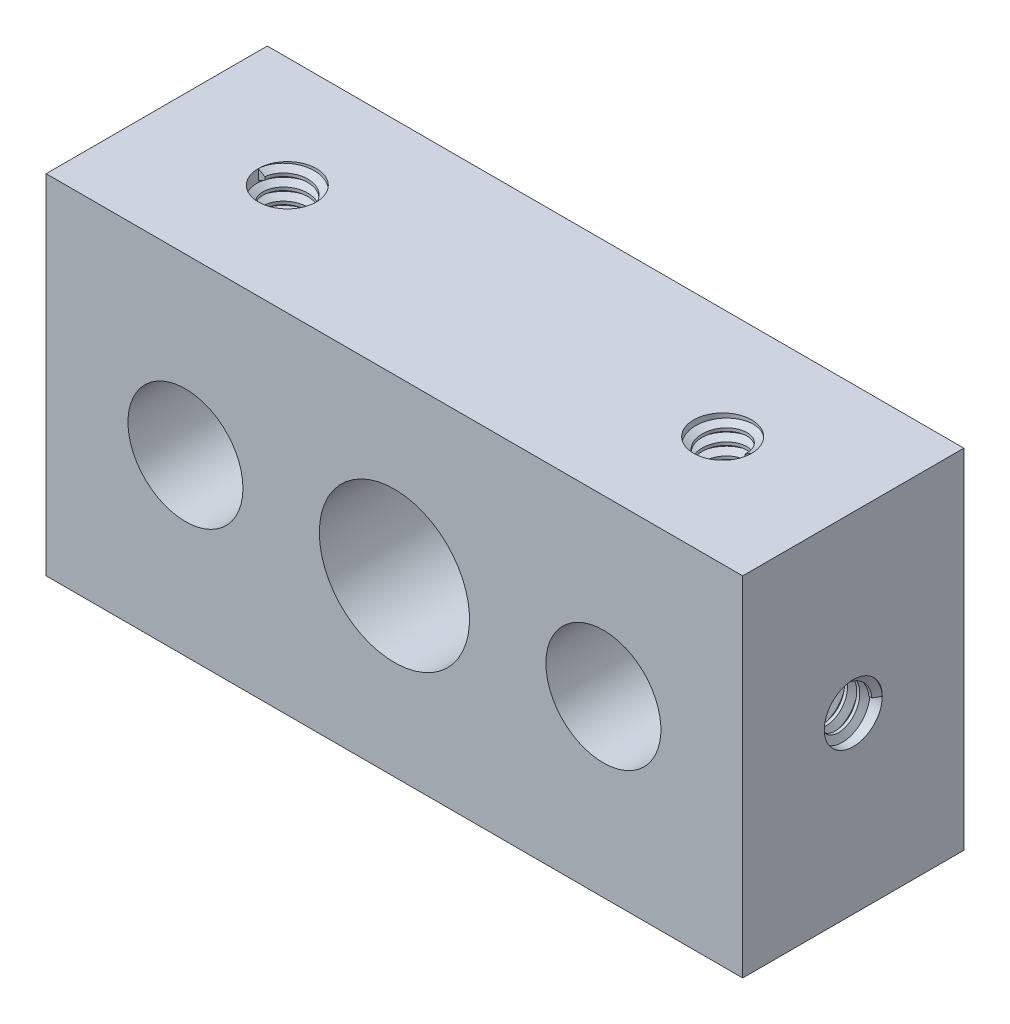
from build123d import *
from build123d.topology import SkipClean

# Parameters (mm, degrees)
SKETCH2_W                       = 40
SKETCH2_H                       = 12.7
BOSS_EXTRUDE1_DEPTH             = 20
TAP_DRILL_FOR_M4X0_7_TAP1_D     = 3.3
TAP_DRILL_FOR_M4X0_7_TAP1_DEPTH = 5
TAP_DRILL_FOR_M4X0_7_TAP1_TIP   = 0.99142
F_1_0MM_DOWEL_HOLE1_D           = 8.6233
F_1_0MM_DOWEL_HOLE1_DEPTH       = 18
F_1_0MM_DOWEL_HOLE1_TIP         = 2.590701
SKETCH8_R                       = 1.666
CUT_EXTRUDE1_DEPTH              = 8
THREAD2_PITCH                   = 0.7
TAP_DRILL_FOR_M4_TAP1_D         = 3.332
TAP_DRILL_FOR_M4_TAP1_DEPTH     = 4.825
TAP_DRILL_FOR_M4_TAP1_TIP       = 1.001034
THREAD3_PITCH                   = 0.7
SKETCH14_R                      = 3.302
CUT_EXTRUDE2_DEPTH              = 32.004901
THREAD4_PITCH                   = 0.7


with BuildPart() as part:
    # Sketch2 → Boss-Extrude1 (new body)
    with BuildSketch(Plane(origin=(0, 0, 0), x_dir=(1, 0, 0), z_dir=(0, 1, 0))):
        Rectangle(SKETCH2_W, SKETCH2_H)
    extrude(amount=BOSS_EXTRUDE1_DEPTH)

    # Tap Drill for M4x0.7 Tap1
    with Locations(Plane(origin=(0, 0, 0), x_dir=(-1, 0, 0), z_dir=(0, -1, 0))):
        with Locations((-12.5, 0), (12.5, 0)):
            Hole(TAP_DRILL_FOR_M4X0_7_TAP1_D / 2, depth=TAP_DRILL_FOR_M4X0_7_TAP1_DEPTH)
            with Locations((0, 0, -(TAP_DRILL_FOR_M4X0_7_TAP1_DEPTH + TAP_DRILL_FOR_M4X0_7_TAP1_TIP / 2))):  # 118° drill point
                Cone(0, TAP_DRILL_FOR_M4X0_7_TAP1_D / 2, TAP_DRILL_FOR_M4X0_7_TAP1_TIP, mode=Mode.SUBTRACT)

    # Ø1.0mm Dowel Hole1
    with Locations(Plane(origin=(0, 0, -6.35), x_dir=(-1, 0, 0), z_dir=(0, 0, -1))):
        with Locations((0, 10)):
            Hole(F_1_0MM_DOWEL_HOLE1_D / 2, depth=F_1_0MM_DOWEL_HOLE1_DEPTH)
            with Locations((0, 0, -(F_1_0MM_DOWEL_HOLE1_DEPTH + F_1_0MM_DOWEL_HOLE1_TIP / 2))):  # 118° drill point
                Cone(0, F_1_0MM_DOWEL_HOLE1_D / 2, F_1_0MM_DOWEL_HOLE1_TIP, mode=Mode.SUBTRACT)

    # Sketch8 → Cut-Extrude1 (cut)
    with BuildSketch(Plane.ZY.offset(20)):
        with Locations((0, 10)):
            Circle(SKETCH8_R)
    cut_extrude1 = extrude(amount=-CUT_EXTRUDE1_DEPTH, mode=Mode.SUBTRACT)

    # Thread2: the profile of Thread Profile3 profile screwed along a right-hand helix of 11.428571 turns, 6 arcs to a turn; built about Z, then put on its axis
    with SkipClean():  # the faces are left unmerged after this step: merging them gives an invalid solid
        thread2_z = Axis((0, 0, 0), (0, 0, 1))
        thread2_corners = [(1.6663, 0, -0.000173), (1.6663, 0, 0.612673), (1.287114, 0, 0.39375), (1.287114, 0, 0.21875)]
        with BuildLine(mode=Mode.PRIVATE) as thread2_profile:
            Line(thread2_corners[0], thread2_corners[1])
            Line(thread2_corners[1], thread2_corners[2])
            Line(thread2_corners[2], thread2_corners[3])
            Line(thread2_corners[3], thread2_corners[0])
        thread2_cap = Face(thread2_profile.wire())
        thread2_turn_angles = [0, 30, 60, 90, 120, 150, 180, 210, 240, 270, 300, 330, 360]
        thread2_turn_weights = [1, 0.8660254037844387, 1, 0.8660254037844387, 1, 0.8660254037844387, 1, 0.8660254037844387, 1, 0.8660254037844387, 1, 0.8660254037844387, 1]
        thread2_turn_rails = [Edge.make_bspline([Vector(p[0], p[1], 0).rotate(thread2_z, thread2_turn_angles[k]) / thread2_turn_weights[k] + Vector(0, 0, p[2] + THREAD2_PITCH * thread2_turn_angles[k] / 360) for k in range(13)], [0, 0, 0, 1, 1, 2, 2, 3, 3, 4, 4, 5, 5, 6, 6, 6], 2, thread2_turn_weights) for p in thread2_corners]
        thread2_turn_sides = [Face.make_surface_from_curves(thread2_turn_rails[p[0]], thread2_turn_rails[p[1]]) for p in [(0, 1), (1, 2), (2, 3), (3, 0)]]
        thread2_last_angles = [3960, 3990, 4020, 4050, 4080, 4097.142857, 4114.285714]
        thread2_last_weights = [1, 0.8660254037844387, 1, 0.8660254037844387, 1, 0.9555728057861397, 1]
        thread2_last_rails = [Edge.make_bspline([Vector(p[0], p[1], 0).rotate(thread2_z, thread2_last_angles[k]) / thread2_last_weights[k] + Vector(0, 0, p[2] + THREAD2_PITCH * thread2_last_angles[k] / 360) for k in range(7)], [0, 0, 0, 1, 1, 2, 2, 3, 3, 3], 2, thread2_last_weights) for p in thread2_corners]
        thread2_last_sides = [Face.make_surface_from_curves(thread2_last_rails[p[0]], thread2_last_rails[p[1]]) for p in [(0, 1), (1, 2), (2, 3), (3, 0)]]
        thread2 = Plane(origin=(-20, 10, 0), x_dir=(0, 0, -1), z_dir=(1, 0, 0)) * Solid(Shell([*[p.moved(Location((0, 0, THREAD2_PITCH * i))) for i in range(11) for p in thread2_turn_sides], *thread2_last_sides, thread2_cap, thread2_cap.rotate(thread2_z, 4114.285714).moved(Location((0, 0, THREAD2_PITCH * 4114.285714 / 360)))]))
        add(thread2)

    # Mirror3: Cut-Extrude1, Thread2 across plane
    with SkipClean():  # the faces are left unmerged after this step: merging them gives an invalid solid
        add(cut_extrude1.mirror(Plane(origin=(0, 0, 0), x_dir=(0, 0, 1), z_dir=(1, 0, 0))), mode=Mode.SUBTRACT)
        add(thread2.mirror(Plane(origin=(0, 0, 0), x_dir=(0, 0, 1), z_dir=(1, 0, 0))))

    # Tap Drill for M4 Tap1
    with Locations(Plane(origin=(0, 20, 0), x_dir=(1, 0, 0), z_dir=(0, 1, 0))):
        with Locations((-12.5, 0), (12.5, 0)):
            Hole(TAP_DRILL_FOR_M4_TAP1_D / 2, depth=TAP_DRILL_FOR_M4_TAP1_DEPTH)
            with Locations((0, 0, -(TAP_DRILL_FOR_M4_TAP1_DEPTH + TAP_DRILL_FOR_M4_TAP1_TIP / 2))):  # 118° drill point
                Cone(0, TAP_DRILL_FOR_M4_TAP1_D / 2, TAP_DRILL_FOR_M4_TAP1_TIP, mode=Mode.SUBTRACT)

    # Thread3: the profile of Thread Profile4 profile screwed along a right-hand helix of 4.035714 turns, 6 arcs to a turn; built about Z, then put on its axis
    with SkipClean():  # the faces are left unmerged after this step: merging them gives an invalid solid
        thread3_z = Axis((0, 0, 0), (0, 0, 1))
        thread3_corners = [(1.6663, 0, -0.000173), (1.6663, 0, 0.612673), (1.287114, 0, 0.39375), (1.287114, 0, 0.21875)]
        with BuildLine(mode=Mode.PRIVATE) as thread3_profile:
            Line(thread3_corners[0], thread3_corners[1])
            Line(thread3_corners[1], thread3_corners[2])
            Line(thread3_corners[2], thread3_corners[3])
            Line(thread3_corners[3], thread3_corners[0])
        thread3_cap = Face(thread3_profile.wire())
        thread3_turn_angles = [0, 30, 60, 90, 120, 150, 180, 210, 240, 270, 300, 330, 360]
        thread3_turn_weights = [1, 0.8660254037844387, 1, 0.8660254037844387, 1, 0.8660254037844387, 1, 0.8660254037844387, 1, 0.8660254037844387, 1, 0.8660254037844387, 1]
        thread3_turn_rails = [Edge.make_bspline([Vector(p[0], p[1], 0).rotate(thread3_z, thread3_turn_angles[k]) / thread3_turn_weights[k] + Vector(0, 0, p[2] + THREAD3_PITCH * thread3_turn_angles[k] / 360) for k in range(13)], [0, 0, 0, 1, 1, 2, 2, 3, 3, 4, 4, 5, 5, 6, 6, 6], 2, thread3_turn_weights) for p in thread3_corners]
        thread3_turn_sides = [Face.make_surface_from_curves(thread3_turn_rails[p[0]], thread3_turn_rails[p[1]]) for p in [(0, 1), (1, 2), (2, 3), (3, 0)]]
        thread3_last_angles = [1440, 1446.428571, 1452.857143]
        thread3_last_weights = [1, 0.9937122098932424, 1]
        thread3_last_rails = [Edge.make_bspline([Vector(p[0], p[1], 0).rotate(thread3_z, thread3_last_angles[k]) / thread3_last_weights[k] + Vector(0, 0, p[2] + THREAD3_PITCH * thread3_last_angles[k] / 360) for k in range(3)], [0, 0, 0, 1, 1, 1], 2, thread3_last_weights) for p in thread3_corners]
        thread3_last_sides = [Face.make_surface_from_curves(thread3_last_rails[p[0]], thread3_last_rails[p[1]]) for p in [(0, 1), (1, 2), (2, 3), (3, 0)]]
        thread3 = Plane(origin=(-12.5, 20, 0), x_dir=(-1, 0, 0), z_dir=(0, -1, 0)) * Solid(Shell([*[p.moved(Location((0, 0, THREAD3_PITCH * i))) for i in range(4) for p in thread3_turn_sides], *thread3_last_sides, thread3_cap, thread3_cap.rotate(thread3_z, 1452.857143).moved(Location((0, 0, THREAD3_PITCH * 1452.857143 / 360)))]))
        add(thread3)

    # Mirror4: Thread3 across plane
    with SkipClean():  # the faces are left unmerged after this step: merging them gives an invalid solid
        add(thread3.mirror(Plane(origin=(0, 0, 0), x_dir=(0, 0, 1), z_dir=(1, 0, 0))))

    # Sketch14 → Cut-Extrude2 (cut, through all)
    with SkipClean():  # the faces are left unmerged after this step: merging them gives an invalid solid
        with BuildSketch(Plane(origin=(0, 0, -6.35), x_dir=(-1, 0, 0), z_dir=(0, 0, -1))):
            with Locations((-12, 10)):
                Circle(SKETCH14_R)
        cut_extrude2 = extrude(amount=-CUT_EXTRUDE2_DEPTH, mode=Mode.SUBTRACT)

    # Mirror5: Cut-Extrude2 across plane
    with SkipClean():  # the faces are left unmerged after this step: merging them gives an invalid solid
        add(cut_extrude2.mirror(Plane(origin=(0, 0, 0), x_dir=(0, 0, 1), z_dir=(1, 0, 0))), mode=Mode.SUBTRACT)

    # Thread4: the profile of Thread Profile5 profile screwed along a right-hand helix of 7.142857 turns, 6 arcs to a turn; built about Z, then put on its axis
    with SkipClean():  # the faces are left unmerged after this step: merging them gives an invalid solid
        thread4_z = Axis((0, 0, 0), (0, 0, 1))
        thread4_corners = [(1.6503, 0, -0.000173), (1.6503, 0, 0.612673), (1.271114, 0, 0.39375), (1.271114, 0, 0.21875)]
        with BuildLine(mode=Mode.PRIVATE) as thread4_profile:
            Line(thread4_corners[0], thread4_corners[1])
            Line(thread4_corners[1], thread4_corners[2])
            Line(thread4_corners[2], thread4_corners[3])
            Line(thread4_corners[3], thread4_corners[0])
        thread4_cap = Face(thread4_profile.wire())
        thread4_turn_angles = [0, 30, 60, 90, 120, 150, 180, 210, 240, 270, 300, 330, 360]
        thread4_turn_weights = [1, 0.8660254037844387, 1, 0.8660254037844387, 1, 0.8660254037844387, 1, 0.8660254037844387, 1, 0.8660254037844387, 1, 0.8660254037844387, 1]
        thread4_turn_rails = [Edge.make_bspline([Vector(p[0], p[1], 0).rotate(thread4_z, thread4_turn_angles[k]) / thread4_turn_weights[k] + Vector(0, 0, p[2] + THREAD4_PITCH * thread4_turn_angles[k] / 360) for k in range(13)], [0, 0, 0, 1, 1, 2, 2, 3, 3, 4, 4, 5, 5, 6, 6, 6], 2, thread4_turn_weights) for p in thread4_corners]
        thread4_turn_sides = [Face.make_surface_from_curves(thread4_turn_rails[p[0]], thread4_turn_rails[p[1]]) for p in [(0, 1), (1, 2), (2, 3), (3, 0)]]
        thread4_last_angles = [2520, 2545.714286, 2571.428571]
        thread4_last_weights = [1, 0.9009688679024066, 1]
        thread4_last_rails = [Edge.make_bspline([Vector(p[0], p[1], 0).rotate(thread4_z, thread4_last_angles[k]) / thread4_last_weights[k] + Vector(0, 0, p[2] + THREAD4_PITCH * thread4_last_angles[k] / 360) for k in range(3)], [0, 0, 0, 1, 1, 1], 2, thread4_last_weights) for p in thread4_corners]
        thread4_last_sides = [Face.make_surface_from_curves(thread4_last_rails[p[0]], thread4_last_rails[p[1]]) for p in [(0, 1), (1, 2), (2, 3), (3, 0)]]
        thread4 = Plane(origin=(12.5, 0, 0), x_dir=(1, 0, 0), z_dir=(0, 1, 0)) * Solid(Shell([*[p.moved(Location((0, 0, THREAD4_PITCH * i))) for i in range(7) for p in thread4_turn_sides], *thread4_last_sides, thread4_cap, thread4_cap.rotate(thread4_z, 2571.428571).moved(Location((0, 0, THREAD4_PITCH * 2571.428571 / 360)))]))
        add(thread4)

    # Mirror6: Thread4 across plane
    with SkipClean():  # the faces are left unmerged after this step: merging them gives an invalid solid
        add(thread4.mirror(Plane(origin=(0, 0, 0), x_dir=(0, 0, 1), z_dir=(1, 0, 0))))


solid = part.part
